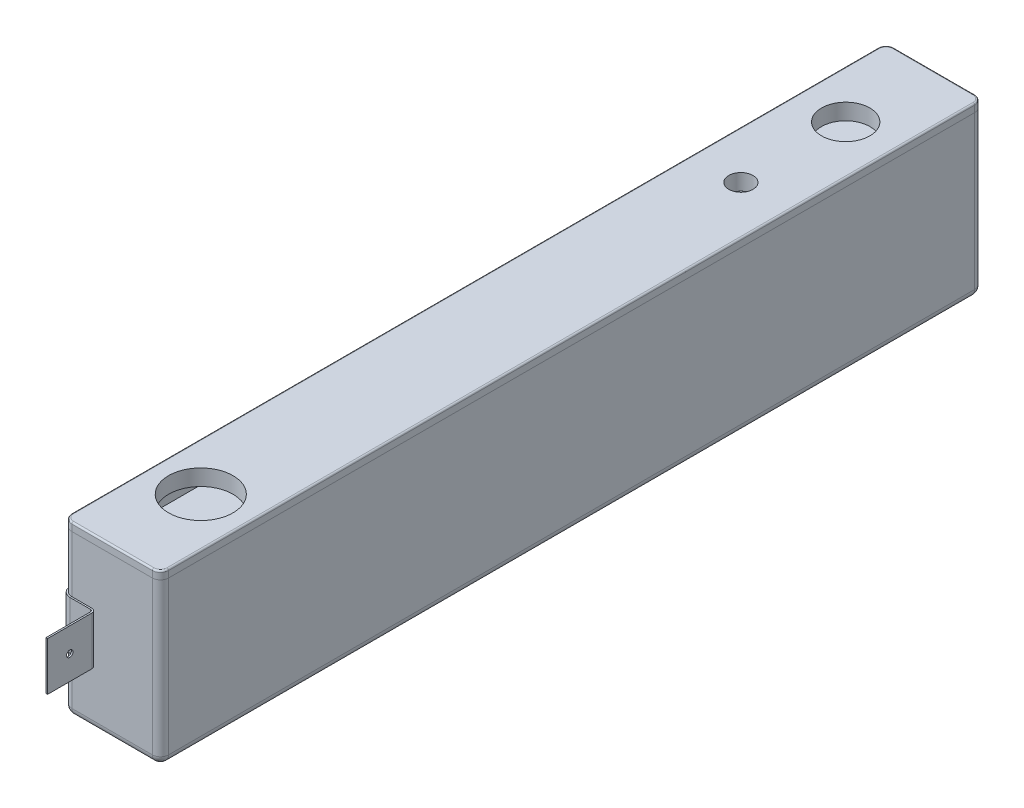
from build123d import *

# Parameters (mm, degrees)
CROQUIS1_W         = 60
CROQUIS1_H         = 510
EXTRUIR1_DEPTH     = 100
REDONDEO1_R        = 5
VACIADO1_T         = -3
CROQUIS2_W         = 54
CROQUIS2_H         = 504
EXTRUIR2_DEPTH     = 80
REDONDEO2_R        = 5
EXTRUIR3_DEPTH     = 5
EXTRUIR4_START     = 5
EXTRUIR4_DEPTH     = 5
REDONDEO3_R        = 1
CROQUIS5_R         = 15
CROQUIS5_R_2       = 7.5
CROQUIS5_R_3       = 20
EXTRUIR5_DEPTH     = 15
DAR_START          = 35
DAR_ESPESOR1_DEPTH = 30
CROQUIS7_R         = 2
EXTRUIR6_DEPTH     = 30


# Read off the part's stored shape, not the designer's step: Dar espesor1
with BuildPart() as part:
    # Croquis1 → Extruir1 (new body)
    with BuildSketch(Plane(origin=(0, 0, 0), x_dir=(1, 0, 0), z_dir=(0, 1, 0))):
        Rectangle(CROQUIS1_W, CROQUIS1_H)
    extrude(amount=EXTRUIR1_DEPTH)

    # Redondeo1
    redondeo1_edges = [part.edges().sort_by_distance(p)[0] for p in [
        (0, 0, 255),
        (-30, 0, 0),
        (0, 0, -255),
        (30, 0, 0),
        (30, 50, 255),
        (-30, 50, 255),
        (-30, 50, -255),
        (30, 50, -255),
    ]]
    fillet(redondeo1_edges, radius=REDONDEO1_R)

    # Vaciado1
    vaciado1_openings = [part.faces().sort_by_distance(p)[0] for p in [
        (0, 100, 0),
    ]]
    offset(amount=VACIADO1_T, openings=vaciado1_openings, kind=Kind.INTERSECTION)


with BuildPart() as body_2:
    # Croquis2 → Extruir2 (new body)
    with BuildSketch(Plane(origin=(0, 3, 0), x_dir=(1, 0, 0), z_dir=(0, 1, 0))):
        Rectangle(CROQUIS2_W, CROQUIS2_H)
    extrude(amount=EXTRUIR2_DEPTH)

    # Redondeo2
    redondeo2_edges = [body_2.edges().sort_by_distance(p)[0] for p in [
        (0, 3, 252),
        (-27, 3, 0),
        (0, 3, -252),
        (27, 3, 0),
        (27, 43, 252),
        (-27, 43, 252),
        (-27, 43, -252),
        (27, 43, -252),
    ]]
    fillet(redondeo2_edges, radius=REDONDEO2_R)


with BuildPart() as body_3:
    # Croquis3 → Extruir3 (new body)
    with BuildSketch(Plane(origin=(0, 100, 0), x_dir=(1, 0, 0), z_dir=(0, 1, 0))):
        with BuildLine():
            Line((25, 253), (-25, 253))
            ThreePointArc((-25, 253), (-27.121320344, 252.121320344), (-28, 250))
            Line((-28, 250), (-28, -250))
            ThreePointArc((-28, -250), (-27.121320344, -252.121320344), (-25, -253))
            Line((-25, -253), (25, -253))
            ThreePointArc((25, -253), (27.121320344, -252.121320344), (28, -250))
            Line((28, -250), (28, 250))
            ThreePointArc((28, 250), (27.121320344, 252.121320344), (25, 253))
        make_face()
    extrude(amount=-EXTRUIR3_DEPTH)

    # Croquis4 → Extruir4 (add)
    with BuildSketch(Plane(origin=(0, 100, 0), x_dir=(1, 0, 0), z_dir=(0, 1, 0)).offset(EXTRUIR4_START)):
        with BuildLine():
            Line((-25, -255), (25, -255))
            ThreePointArc((25, -255), (28.535533906, -253.535533906), (30, -250))
            Line((30, -250), (30, 250))
            ThreePointArc((30, 250), (28.535533906, 253.535533906), (25, 255))
            Line((25, 255), (-25, 255))
            ThreePointArc((-25, 255), (-28.535533906, 253.535533906), (-30, 250))
            Line((-30, 250), (-30, -250))
            ThreePointArc((-30, -250), (-28.535533906, -253.535533906), (-25, -255))
        make_face()
    extrude(amount=-EXTRUIR4_DEPTH)

    # Redondeo3
    redondeo3_edges = [body_3.edges().sort_by_distance(p)[0] for p in [
        (-28.535533906, 105, 253.535533906),
        (0, 105, 255),
        (28.535533906, 105, 253.535533906),
        (30, 105, 0),
        (28.535533906, 105, -253.535533906),
        (0, 105, -255),
        (-28.535533906, 105, -253.535533906),
        (-30, 105, 0),
    ]]
    fillet(redondeo3_edges, radius=REDONDEO3_R)

    # Croquis5 → Extruir5 (cut)
    with BuildSketch(Plane(origin=(0, 105, 0), x_dir=(1, 0, 0), z_dir=(0, 1, 0))):
        with Locations(Location((0, 200, 0), (0, 0, 270))):
            Circle(CROQUIS5_R)
        with Locations(Location((0, 135, 0), (0, 0, 270))):
            Circle(CROQUIS5_R_2)
        with Locations(Location((0, -200, 0), (0, 0, 270))):
            Circle(CROQUIS5_R_3)
    extrude(amount=-EXTRUIR5_DEPTH, mode=Mode.SUBTRACT)


with BuildPart() as body_4:
    # Dar espesor1 outline → Dar espesor1 (new body)
    with BuildSketch(Plane(origin=(0, 0, 0), x_dir=(1, 0, 0), z_dir=(0, 1, 0)).offset(DAR_START)):
        with BuildLine():
            Line((-10, 257.5), (-10, 285))
            Line((-10, 285), (-11, 285))
            Line((-11, 285), (-11, 257.5))
            ThreePointArc((-11, 257.5), (-11.439339828, 256.439339828), (-12.5, 256))
            Line((-12.5, 256), (-25, 256))
            ThreePointArc((-25, 256), (-29.242640687, 254.242640687), (-31, 250))
            Line((-31, 250), (-31, -250))
            ThreePointArc((-31, -250), (-29.242640687, -254.242640687), (-25, -256))
            Line((-25, -256), (-12.5, -256))
            ThreePointArc((-12.5, -256), (-11.439339828, -256.439339828), (-11, -257.5))
            Line((-11, -257.5), (-11, -285))
            Line((-11, -285), (-10, -285))
            Line((-10, -285), (-10, -257.5))
            ThreePointArc((-10, -257.5), (-10.732233047, -255.732233047), (-12.5, -255))
            Line((-12.5, -255), (-25, -255))
            ThreePointArc((-25, -255), (-28.535533906, -253.535533906), (-30, -250))
            Line((-30, -250), (-30, 250))
            ThreePointArc((-30, 250), (-28.535533906, 253.535533906), (-25, 255))
            Line((-25, 255), (-12.5, 255))
            ThreePointArc((-12.5, 255), (-10.732233047, 255.732233047), (-10, 257.5))
        make_face()
    extrude(amount=DAR_ESPESOR1_DEPTH)

    # Croquis7 → Extruir6 (cut)
    with BuildSketch(Plane.ZY.offset(11)):
        with Locations((-271.25, 50)):
            Circle(CROQUIS7_R)
    extruir6 = extrude(amount=-EXTRUIR6_DEPTH, mode=Mode.SUBTRACT)

    # Simetría1: Extruir6 across plane
    add(extruir6.mirror(Plane.XY), mode=Mode.SUBTRACT)


solid = Compound([part.part, body_2.part, body_3.part, body_4.part])
